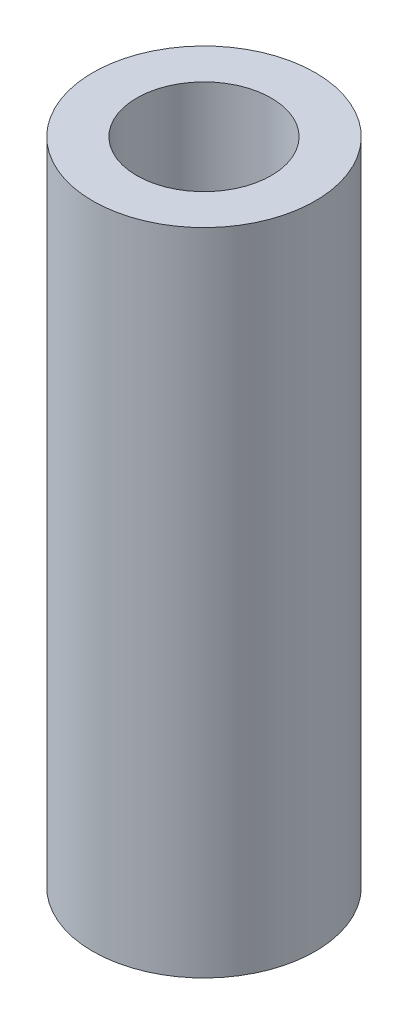
from build123d import *

# Parameters (mm, degrees)
SKETCH1_R           = 7.5
BOSS_EXTRUDE1_DEPTH = 43.822766615
SKETCH2_R           = 4.535290132
CUT_EXTRUDE1_DEPTH  = 46.088079065


with BuildPart() as part:
    # Sketch1 → Boss-Extrude1 (new body)
    with BuildSketch(Plane(origin=(0, 0, 0), x_dir=(1, 0, 0), z_dir=(0, 1, 0))):
        Circle(SKETCH1_R)
    extrude(amount=BOSS_EXTRUDE1_DEPTH)

    # Sketch2 → Cut-Extrude1 (cut, through all)
    with BuildSketch(Plane(origin=(0, 0, 0), x_dir=(1, 0, 0), z_dir=(0, 1, 0))):
        Circle(SKETCH2_R)
    extrude(amount=CUT_EXTRUDE1_DEPTH, mode=Mode.SUBTRACT)


solid = part.part
